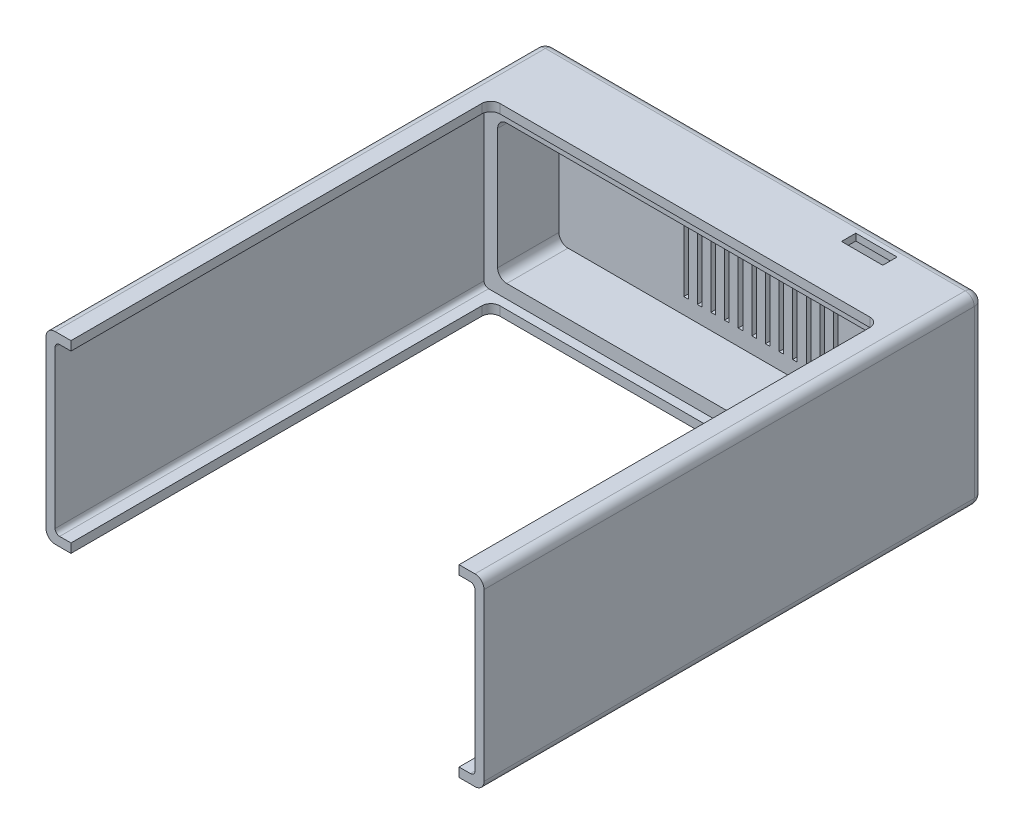
from build123d import *

# Parameters (mm, degrees)
IZIM1_W                     = 96.5
IZIM1_H                     = 40.6
Y_KSEKLIK_EKSTR_ZYON1_DEPTH = 110
KES_EKSTR_ZYON1_DEPTH       = 92.5
IZIM3_W                     = 92.5
IZIM3_H                     = 36.6
KES_EKSTR_ZYON2_DEPTH       = 2
IZIM4_W                     = 86.5
IZIM4_H                     = 30.6
KES_EKSTR_ZYON3_DEPTH       = 13.5
RADYUS1_R                   = 2
RADYUS2_R                   = 1
IZIM5_W                     = 20
IZIM5_H                     = 5
KES_EKSTR_ZYON4_DEPTH       = 3.5
IZIM6_W                     = 9.1
IZIM6_H                     = 3.15
KES_EKSTR_ZYON5_DEPTH       = 1.5
IZIM7_W                     = 1
IZIM7_H                     = 23.6
KES_EKSTR_ZYON6_DEPTH       = 2


with BuildPart() as part:
    # Çizim1 → Yükseklik-Ekstrüzyon1 (new body)
    with BuildSketch(Plane.XY):
        Rectangle(IZIM1_W, IZIM1_H)
    extrude(amount=Y_KSEKLIK_EKSTR_ZYON1_DEPTH)

    # Çizim2 → Kes-Ekstrüzyon1 (cut)
    with BuildSketch(Plane.XY.offset(110)):
        Polygon((-46.25, -18.3), (-42.75, -18.3), (-42.75, -20.3), (42.75, -20.3), (42.75, -18.3), (46.25, -18.3), (46.25, 18.3), (42.75, 18.3), (42.75, 20.3), (-42.75, 20.3), (-42.75, 18.3), (-46.25, 18.3), align=None)
    extrude(amount=-KES_EKSTR_ZYON1_DEPTH, mode=Mode.SUBTRACT)

    # Çizim3 → Kes-Ekstrüzyon2 (cut)
    with BuildSketch(Plane.XY.offset(17.5)):
        Rectangle(IZIM3_W, IZIM3_H)
    extrude(amount=-KES_EKSTR_ZYON2_DEPTH, mode=Mode.SUBTRACT)

    # Çizim4 → Kes-Ekstrüzyon3 (cut)
    with BuildSketch(Plane.XY.offset(15.5)):
        Rectangle(IZIM4_W, IZIM4_H)
    extrude(amount=-KES_EKSTR_ZYON3_DEPTH, mode=Mode.SUBTRACT)

    # Radyus1
    radyus1_edges = [part.edges().sort_by_distance(p)[0] for p in [
        (42.75, -19.3, 17.5),
        (-42.75, -19.3, 17.5),
        (-42.75, 19.3, 17.5),
        (42.75, 19.3, 17.5),
        (0, -20.3, 0),
        (-48.25, 0, 0),
        (0, 20.3, 0),
        (48.25, 0, 0),
        (43.25, 15.3, 8.75),
        (43.25, -15.3, 8.75),
        (-43.25, -15.3, 8.75),
        (-43.25, 15.3, 8.75),
        (48.25, -20.3, 55),
        (-48.25, -20.3, 55),
        (-48.25, 20.3, 55),
        (48.25, 20.3, 55),
    ]]
    fillet(radyus1_edges, radius=RADYUS1_R)

    # Radyus2
    radyus2_edges = [part.edges().sort_by_distance(p)[0] for p in [
        (46.25, 18.3, 62.75),
        (46.25, -18.3, 62.75),
        (-46.25, -18.3, 62.75),
        (-46.25, 18.3, 62.75),
    ]]
    fillet(radyus2_edges, radius=RADYUS2_R)

    # Çizim5 → Kes-Ekstrüzyon4 (cut)
    with BuildSketch(Plane.XZ.offset(-15.3)):
        with Locations((27.75, 4.5)):
            Rectangle(IZIM5_W, IZIM5_H)
    extrude(amount=-KES_EKSTR_ZYON4_DEPTH, mode=Mode.SUBTRACT)

    # Pah3
    # the kernel refuses this chamfer: 8.5, 5 mm, written as the material it takes off along each edge
    with BuildSketch(Plane(origin=(37.75, 15.3, 7), x_dir=(0, -0.01960111388009259, 0.9998078797122274), z_dir=(-1, 0, 0))) as pah3_piece_1_section:
        with BuildLine():
            Line((8.794747283, 0), (-0.394385874, 5.165648867))
            Line((-0.394385874, 5.165648867), (-0.564353214, 5.162316677))
            ThreePointArc((-0.564353214, 5.162316677), (-0.220659611, 2.582364372), (-0.16996734, -0.003332189))
            Line((-0.16996734, -0.003332189), (0.003332189, -0.16996734))
            ThreePointArc((0.003332189, -0.16996734), (4.399016344, -0.083790478), (8.798079472, -0.16996734))
            Line((8.798079472, -0.16996734), (8.794747283, 0))
        make_face()
    pah3_piece_1 = extrude(amount=20, mode=Mode.PRIVATE)
    pah3_piece_1 = split(pah3_piece_1, bisect_by=Plane(origin=(27.75, 18.8, 10.101795291), z_dir=(0, -1, 0)), keep=Keep.TOP, mode=Mode.PRIVATE)
    add(pah3_piece_1, mode=Mode.SUBTRACT)

    # Çizim6 → Kes-Ekstrüzyon5 (cut)
    with BuildSketch(Plane.XZ.offset(-18.8)):
        with Locations((27.75, 4.625)):
            Rectangle(IZIM6_W, IZIM6_H)
    extrude(amount=-KES_EKSTR_ZYON5_DEPTH, mode=Mode.SUBTRACT)

    # Çizim7 → Kes-Ekstrüzyon6 (cut)
    with BuildSketch(Plane.XY.offset(2)):
        with Locations((17.75, 0)):
            Rectangle(IZIM7_W, IZIM7_H)
        with Locations((14.75, 0)):
            Rectangle(IZIM7_W, IZIM7_H)
        with Locations((11.75, 0)):
            Rectangle(IZIM7_W, IZIM7_H)
        with Locations((8.75, 0)):
            Rectangle(IZIM7_W, IZIM7_H)
        with Locations((5.75, 0)):
            Rectangle(IZIM7_W, IZIM7_H)
        with Locations((2.75, 0)):
            Rectangle(IZIM7_W, IZIM7_H)
        with Locations((-0.25, 0)):
            Rectangle(IZIM7_W, IZIM7_H)
        with Locations((-3.25, 0)):
            Rectangle(IZIM7_W, IZIM7_H)
        with Locations((-6.25, 0)):
            Rectangle(IZIM7_W, IZIM7_H)
        with Locations((-9.25, 0)):
            Rectangle(IZIM7_W, IZIM7_H)
        with Locations((-12.25, 0)):
            Rectangle(IZIM7_W, IZIM7_H)
        with Locations((-15.25, 0)):
            Rectangle(IZIM7_W, IZIM7_H)
    extrude(amount=-KES_EKSTR_ZYON6_DEPTH, mode=Mode.SUBTRACT)


solid = part.part
